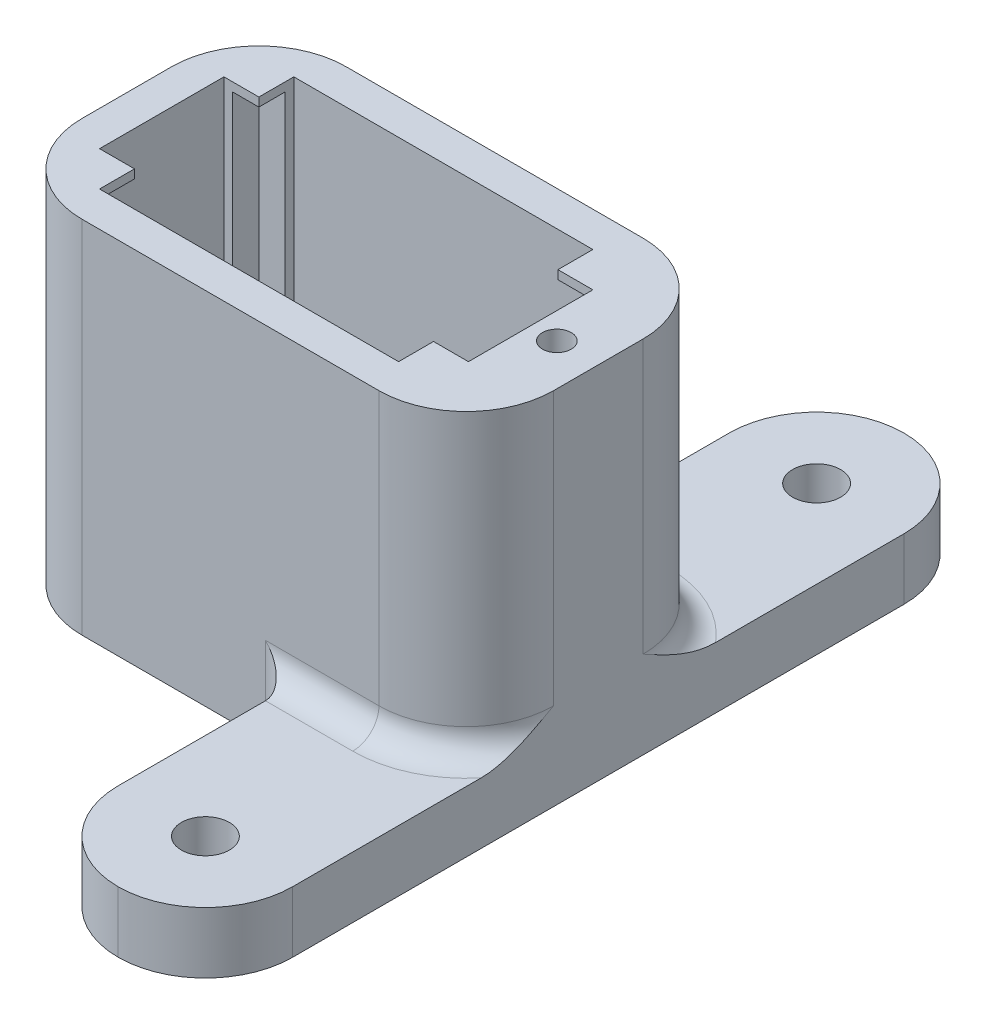
from build123d import *

# Parameters (mm, degrees)
BOSS_EXTRUDE1_DEPTH                   = 1
BOSS_EXTRUDE1_DEPTH_BACK              = 19
SKETCH1_W                             = 50.25
SKETCH1_H                             = 30.25
BOSS_EXTRUDE2_DEPTH                   = 30.25
BOSS_EXTRUDE3_DEPTH                   = 5
M6_CLEARANCE_HOLE1_D                  = 6.6
M6_CLEARANCE_HOLE1_CSINK_D            = 6.65
M6_CLEARANCE_HOLE1_CSINK_ANGLE        = 90
SKETCH6_W                             = 4
SKETCH6_H                             = 4
BOSS_EXTRUDE4_DEPTH                   = 1
FILLET1_R                             = 10
TAP_DRILL_FOR_M4X0_7_TAP1_D           = 3.3
TAP_DRILL_FOR_M4X0_7_TAP1_CSINK_D     = 3.35
TAP_DRILL_FOR_M4X0_7_TAP1_CSINK_ANGLE = 90
CUT_EXTRUDE1_DEPTH                    = 92.330529534
CUT_EXTRUDE1_DEPTH_BACK               = 92.330529534
SKETCH13_OUTSIDE_W                    = 121.742
SKETCH13_OUTSIDE_H                    = 131.492
BOSS_EXTRUDE5_START                   = 21.26
BOSS_EXTRUDE5_DEPTH                   = 21.26
CUT_EXTRUDE2_DEPTH                    = 53.582495662
CUT_EXTRUDE2_DEPTH_BACK               = 53.582495662
SKETCH15_R                            = 1.65
BOSS_EXTRUDE6_REACH                   = 66.778
SKETCH16_W                            = 10
SKETCH16_H                            = 7
SKETCH17_W                            = 29.875
SKETCH17_H                            = 7
BOSS_EXTRUDE7_DEPTH                   = 20
FILLET5_R                             = 10
FILLET6_R                             = 3
SKETCH19_R                            = 2.75
CUT_EXTRUDE4_DEPTH                    = 64.502072703
FILLET7_R                             = 3
FILLET8_R                             = 10


with BuildPart() as part:
    # Sketch1 → Boss-Extrude1 (new, two sides: drawn at the far end of the back side and taken through both)
    with BuildSketch(Plane(origin=(0, 20.13, 0), x_dir=(1, 0, 0), z_dir=(0, 1, 0)).offset(-BOSS_EXTRUDE1_DEPTH_BACK)):
        Rectangle(SKETCH1_W, SKETCH1_H)
        Polygon((20.125, 10.125), (17.125, 10.125), (17.125, 11.125), (-17.125, 11.125), (-17.125, 10.125), (-20.125, 10.125), (-20.125, 7.125), (-21.125, 7.125), (-21.125, -7.125), (-20.125, -7.125), (-20.125, -10.125), (-17.125, -10.125), (-17.125, -11.125), (17.125, -11.125), (17.125, -10.125), (20.125, -10.125), (20.125, -7.125), (21.125, -7.125), (21.125, 7.125), (20.125, 7.125), align=None, mode=Mode.SUBTRACT)
    extrude(amount=BOSS_EXTRUDE1_DEPTH + BOSS_EXTRUDE1_DEPTH_BACK)

    # Sketch2 → Boss-Extrude2 (add)
    with BuildSketch(Plane.XY.offset(15.125)):
        Polygon((25.125, 21.13), (45.125, 21.13), (45.125, 61.13), (65.125, 61.13), (65.125, 1.13), (25.125, 1.13), align=None)
    extrude(amount=-BOSS_EXTRUDE2_DEPTH)

    # Sketch3 → Boss-Extrude3 (add)
    with BuildSketch(Plane(origin=(0, 61.13, 0), x_dir=(1, 0, 0), z_dir=(0, 1, 0))):
        with BuildLine():
            Line((65.125, 40), (65.125, -40))
            ThreePointArc((65.125, -40), (55.125, -50), (45.125, -40))
            Line((45.125, -40), (45.125, 40))
            ThreePointArc((45.125, 40), (55.125, 50), (65.125, 40))
        make_face()
    extrude(amount=-BOSS_EXTRUDE3_DEPTH)

    # M6 Clearance Hole1 (through all)
    with Locations(Plane(origin=(0, 56.13, 0), x_dir=(-1, 0, 0), z_dir=(0, -1, 0))):
        with Locations((-55.125, -40), (-55.125, 40)):
            CounterSinkHole(M6_CLEARANCE_HOLE1_D / 2, M6_CLEARANCE_HOLE1_CSINK_D / 2, counter_sink_angle=M6_CLEARANCE_HOLE1_CSINK_ANGLE)

    # Sketch6 → Boss-Extrude4 (add)
    with BuildSketch(Plane(origin=(0, 21.13, 0), x_dir=(1, 0, 0), z_dir=(0, 1, 0))):
        with Locations((19.125, 9.125)):
            Rectangle(SKETCH6_W, SKETCH6_H)
        with Locations((19.125, -9.125)):
            Rectangle(SKETCH6_W, SKETCH6_H)
        with Locations((-19.125, -9.125)):
            Rectangle(SKETCH6_W, SKETCH6_H)
        with Locations((-19.125, 9.125)):
            Rectangle(SKETCH6_W, SKETCH6_H)
    extrude(amount=-BOSS_EXTRUDE4_DEPTH)

    # Fillet1
    fillet1_edges = [part.edges().sort_by_distance(p)[0] for p in [
        (45.125, 21.13, 0),
        (65.125, 1.13, 0),
        (55.125, 56.13, -15.125),
        (55.125, 56.13, 15.125),
        (-25.125, 11.13, 15.125),
        (-25.125, 11.13, -15.125),
    ]]
    fillet(fillet1_edges, radius=FILLET1_R)

    # Tap Drill for M4x0.7 Tap1 (through all)
    with Locations(Plane(origin=(0, 1.13, 0), x_dir=(-1, 0, 0), z_dir=(0, -1, 0))):
        with Locations((-24.125, 0)):
            CounterSinkHole(TAP_DRILL_FOR_M4X0_7_TAP1_D / 2, TAP_DRILL_FOR_M4X0_7_TAP1_CSINK_D / 2, counter_sink_angle=TAP_DRILL_FOR_M4X0_7_TAP1_CSINK_ANGLE)

    # Sketch13 outside → Cut-Extrude1 (cut, two sides: drawn at the far end of the back side and taken through both)
    with BuildSketch(Plane(origin=(0, 21.13, 0), x_dir=(1, 0, 0), z_dir=(0, 1, 0)).offset(-CUT_EXTRUDE1_DEPTH_BACK)):
        with Locations((20, 0)):
            Rectangle(SKETCH13_OUTSIDE_W, SKETCH13_OUTSIDE_H)
        with BuildLine():
            Line((28.875, 5.125), (28.875, -5.125))
            ThreePointArc((28.875, -5.125), (25.946067812, -12.196067812), (18.875, -15.125))
            Line((18.875, -15.125), (-15.125, -15.125))
            ThreePointArc((-15.125, -15.125), (-22.196067812, -12.196067812), (-25.125, -5.125))
            Line((-25.125, -5.125), (-25.125, 5.125))
            ThreePointArc((-25.125, 5.125), (-22.196067812, 12.196067812), (-15.125, 15.125))
            Line((-15.125, 15.125), (18.875, 15.125))
            ThreePointArc((18.875, 15.125), (25.946067812, 12.196067812), (28.875, 5.125))
        make_face(mode=Mode.SUBTRACT)
    extrude(amount=CUT_EXTRUDE1_DEPTH + CUT_EXTRUDE1_DEPTH_BACK, mode=Mode.SUBTRACT)

    # Sketch14 → Boss-Extrude5 (add)
    with BuildSketch(Plane.XZ.offset(-1.13).offset(BOSS_EXTRUDE5_START)):
        with BuildLine():
            Line((28.875, 5.125), (28.875, -5.125))
            ThreePointArc((28.875, -5.125), (25.946067812, -12.196067812), (18.875, -15.125))
            Line((18.875, -15.125), (-15.125, -15.125))
            ThreePointArc((-15.125, -15.125), (-22.196067812, -12.196067812), (-25.125, -5.125))
            Line((-25.125, -5.125), (-25.125, 5.125))
            ThreePointArc((-25.125, 5.125), (-22.196067812, 12.196067812), (-15.125, 15.125))
            Line((-15.125, 15.125), (18.875, 15.125))
            ThreePointArc((18.875, 15.125), (25.946067812, 12.196067812), (28.875, 5.125))
        make_face()
        Polygon((-21.125, 7.125), (-20.125, 7.125), (-20.125, 10.125), (-17.125, 10.125), (-17.125, 11.125), (17.125, 11.125), (17.125, 10.125), (20.125, 10.125), (20.125, 7.125), (21.125, 7.125), (21.125, -7.125), (20.125, -7.125), (20.125, -10.125), (17.125, -10.125), (17.125, -11.125), (-17.125, -11.125), (-17.125, -10.125), (-20.125, -10.125), (-20.125, -7.125), (-21.125, -7.125), align=None, mode=Mode.SUBTRACT)
    extrude(amount=-BOSS_EXTRUDE5_DEPTH)

    # Sketch15 → Cut-Extrude2 (cut, two sides: drawn at the far end of the back side and taken through both)
    with BuildSketch(Plane(origin=(0, 21.13, 0), x_dir=(1, 0, 0), z_dir=(0, 1, 0)).offset(-CUT_EXTRUDE2_DEPTH_BACK)):
        with Locations(Location((24.125, 0, 0), (0, 0, 90))):
            Circle(SKETCH15_R)
    extrude(amount=CUT_EXTRUDE2_DEPTH + CUT_EXTRUDE2_DEPTH_BACK, mode=Mode.SUBTRACT)

    # Sketch16 → Boss-Extrude6 (add, up to next)
    with BuildSketch(Plane(origin=(28.875, 0, 13.75), x_dir=(0, 0, 1), z_dir=(-1, 0, 0)), mode=Mode.PRIVATE) as boss_extrude6_sk1:
        with Locations((-23.875, -16.63)):
            Rectangle(SKETCH16_W, SKETCH16_H)
    boss_extrude6_tool1 = extrude(boss_extrude6_sk1.sketch, amount=BOSS_EXTRUDE6_REACH, mode=Mode.PRIVATE) - part.part
    boss_extrude6 = boss_extrude6_tool1.solids().sort_by_distance((28.875, -16.63, -10.125))[0]
    add(boss_extrude6)

    # Sketch17 → Boss-Extrude7 (add)
    with BuildSketch(Plane.ZY.offset(-28.875)):
        with Locations((-30.0625, -16.63)):
            Rectangle(SKETCH17_W, SKETCH17_H)
    boss_extrude7 = extrude(amount=BOSS_EXTRUDE7_DEPTH)

    # Fillet5
    fillet5_edges = [part.edges().sort_by_distance(p)[0] for p in [
        (8.875, -16.63, -45),
        (28.875, -16.63, -45),
    ]]
    fillet(fillet5_edges, radius=FILLET5_R - 0.0001)  # a hair under: the kernel refuses the full size

    # Fillet6
    fillet6_edges = [part.edges().sort_by_distance(p)[0] for p in [
        (25.946067812, -13.13, -12.196067812),
        (13.875, -13.13, -15.125),
        (8.875, -16.63, -15.125),
    ]]
    fillet(fillet6_edges, radius=FILLET6_R)

    # Sketch19 → Cut-Extrude4 (cut, through all)
    with BuildSketch(Plane(origin=(0, -13.13, 0), x_dir=(1, 0, 0), z_dir=(0, 1, 0))):
        with Locations(Location((18.875, 35, 0), (0, 0, 270))):
            Circle(SKETCH19_R)
    cut_extrude4 = extrude(amount=-CUT_EXTRUDE4_DEPTH, mode=Mode.SUBTRACT)

    # Mirror2: Boss-Extrude6 across plane
    add(boss_extrude6.mirror(Plane.XY))

    # Mirror4: Boss-Extrude7 across plane
    add(boss_extrude7.mirror(Plane.XY))

    # Fillet7
    fillet7_edges = [part.edges().sort_by_distance(p)[0] for p in [
        (13.875, -13.13, 15.125),
        (25.946067812, -13.13, 12.196067812),
    ]]
    fillet(fillet7_edges, radius=FILLET7_R)
    fillet7_2_edges = [part.edges().sort_by_distance(p)[0] for p in [
        (8.875, -16.63, 15.125),
    ]]
    fillet(fillet7_2_edges, radius=FILLET7_R)

    # Fillet8
    fillet8_edges = [part.edges().sort_by_distance(p)[0] for p in [
        (8.875, -16.63, 45),
        (28.875, -16.63, 45),
    ]]
    fillet(fillet8_edges, radius=FILLET8_R - 0.0001)  # a hair under: the kernel refuses the full size

    # Mirror8: Cut-Extrude4 across plane
    add(cut_extrude4.mirror(Plane.XY), mode=Mode.SUBTRACT)


solid = part.part
